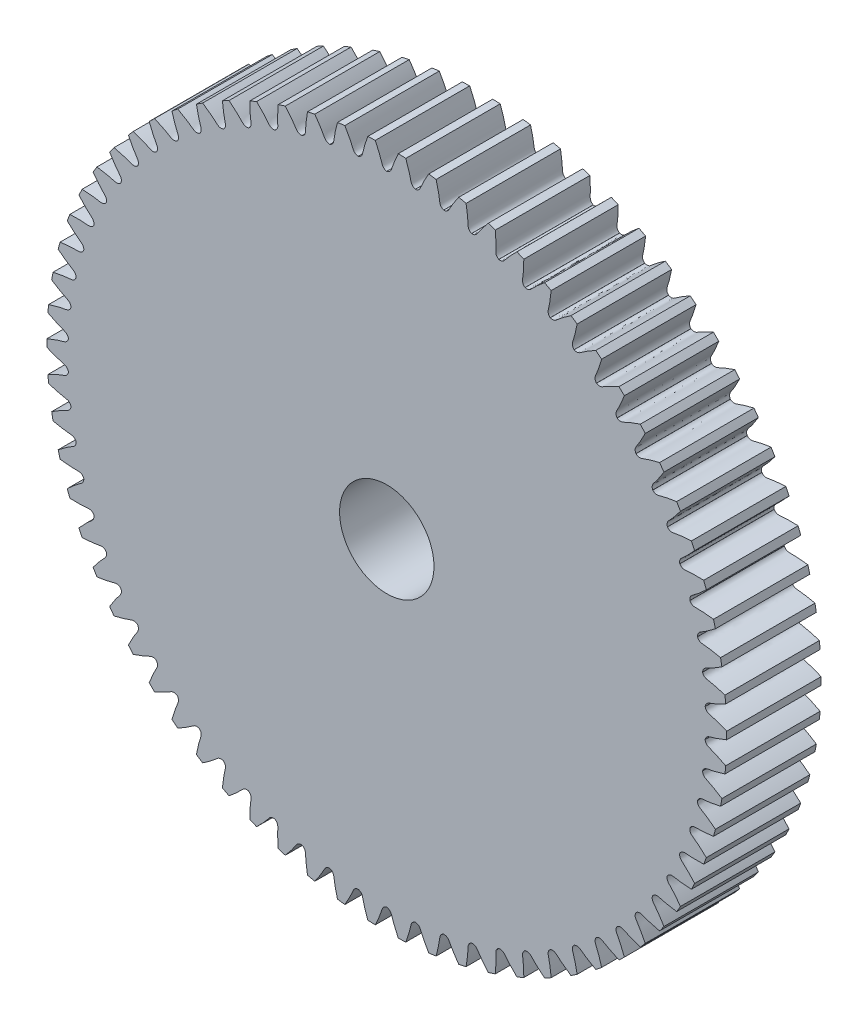
from build123d import *

# Parameters (mm, degrees)
SKETCH_1_R               = 108
EXTRUDE_1_DEPTH          = 30
CUT_EXTRUDE_1_DEPTH      = 156.653461253
PATTERN_CIRCULAR_1_COUNT = 70
SKETCH_4_R               = 15
CUT_EXTRUDE_2_DEPTH      = 300


with BuildPart() as part:
    # 草图1 → 凸台-拉伸1 (new body)
    with BuildSketch(Plane.XY):
        Circle(SKETCH_1_R)
    extrude(amount=EXTRUDE_1_DEPTH)

    # 草图2 → 切除-拉伸1 (cut, through all)
    with BuildSketch(Plane.XY):
        with BuildLine():
            ThreePointArc((0.01, 101.249345193), (0, 101.249345687), (-0.01, 101.249345193))
            add(Edge.make_bspline(
                [(-0.01, 101.249345193), (-1.286678546, 101.50532828), (-1.517107489, 102.635559182), (-1.960346755, 103.910062827), (-2.188625728, 104.542229874), (-2.445029834, 105.205716988), (-2.72919681, 105.900716395), (-3.042979017, 106.626054095), (-3.387553639, 107.380900223), (-3.764261388, 108.164272591), (-4.174362278, 108.975181242), (-4.619104669, 109.812587613), (-5.09970405, 110.675417167), (-5.617347772, 111.562556701), (-6.173192368, 112.472856074), (-6.768363017, 113.405128707), (-7.403952422, 114.358152468), (-8.081019876, 115.330670474), (-8.800590311, 116.321391952), (-9.56365334, 117.328993117), (-10.371162463, 118.352118069), (-11.224033767, 119.38937972), (-12.439965486, 120.809340685), (-13.397310311, 121.860846204), (-14.057950946, 122.558719258)],
                knots=[0, 0, 0, 0, 0.106638293, 0.131170116, 0.157232942, 0.184826771, 0.213951602, 0.244607436, 0.276794272, 0.310512111, 0.345760953, 0.382540797, 0.420851643, 0.460693492, 0.502066344, 0.544970198, 0.589405055, 0.635370914, 0.682867776, 0.73189564, 0.782454507, 0.834544376, 0.888165248, 1, 1, 1, 1], degree=3))
            ThreePointArc((-14.057950946, 122.558719258), (0, 123.362334815), (14.057950946, 122.558719258))
            add(Edge.make_bspline(
                [(0.01, 101.249345193), (1.286678546, 101.50532828), (1.517107489, 102.635559182), (1.960346755, 103.910062827), (2.188625728, 104.542229874), (2.445029834, 105.205716988), (2.72919681, 105.900716395), (3.042979017, 106.626054095), (3.387553639, 107.380900223), (3.764261388, 108.164272591), (4.174362278, 108.975181242), (4.619104669, 109.812587613), (5.09970405, 110.675417167), (5.617347772, 111.562556701), (6.173192368, 112.472856074), (6.768363017, 113.405128707), (7.403952422, 114.358152468), (8.081019876, 115.330670474), (8.800590311, 116.321391952), (9.56365334, 117.328993117), (10.371162463, 118.352118069), (11.224033767, 119.38937972), (12.439965486, 120.809340685), (13.397310311, 121.860846204), (14.057950946, 122.558719258)],
                knots=[0, 0, 0, 0, 0.106638293, 0.131170116, 0.157232942, 0.184826771, 0.213951602, 0.244607436, 0.276794272, 0.310512111, 0.345760953, 0.382540797, 0.420851643, 0.460693492, 0.502066344, 0.544970198, 0.589405055, 0.635370914, 0.682867776, 0.73189564, 0.782454507, 0.834544376, 0.888165248, 1, 1, 1, 1], degree=3))
        make_face()
    cut_extrude_1 = extrude(amount=CUT_EXTRUDE_1_DEPTH, mode=Mode.SUBTRACT)

    # 阵列(圆周)1: 切除-拉伸1 ×70 about axis
    pattern_circular_1_axis = Axis((0, 0, 30), (0, 0, -1))
    for i in range(1, PATTERN_CIRCULAR_1_COUNT):
        add(cut_extrude_1.rotate(pattern_circular_1_axis, i * 360 / PATTERN_CIRCULAR_1_COUNT), mode=Mode.SUBTRACT)

    # 草图4 → 切除-拉伸2 (cut)
    with BuildSketch(Plane.XY.offset(30)):
        Circle(SKETCH_4_R)
    extrude(amount=-CUT_EXTRUDE_2_DEPTH, mode=Mode.SUBTRACT)


solid = part.part
